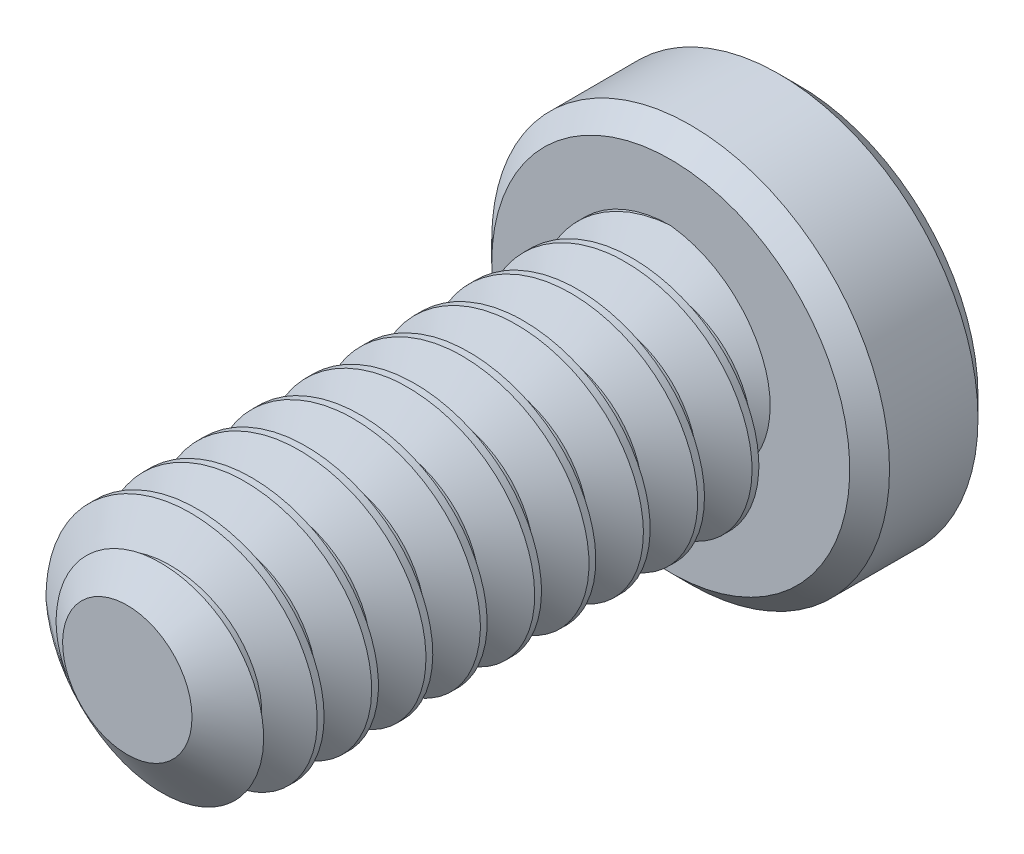
from build123d import *

# Parameters (mm, degrees)
SKETCH1_R          = 1.4224
EXTRUDE1_DEPTH     = 6.35
CUT_SWEEP1_PITCH   = 0.635
SKETCH6_R          = 2.3241
EXTRUDE2_DEPTH     = 1.4986
CUT_EXTRUDE1_DEPTH = 0.9525
CHAMFER1_SIZE      = 0.23241


with BuildPart() as part:
    # Sketch1 → Extrude1 (new body)
    with BuildSketch(Plane.XY):
        Circle(SKETCH1_R)
    extrude(amount=-EXTRUDE1_DEPTH)

    # Cut-Sweep1: the profile of Sketch3 profile screwed along a right-hand helix of 11 turns, 6 arcs to a turn; built about Z, then put on its axis
    cut_sweep1_z = Axis((0, 0, 0), (0, 0, 1))
    cut_sweep1_corners = [(1.4227, 0, -0.555798205), (1.009955401, 0, -0.3175), (1.009955401, 0, -0.238125), (1.4227, 0, 0.000173205)]
    with BuildLine(mode=Mode.PRIVATE) as cut_sweep1_profile:
        Line(cut_sweep1_corners[0], cut_sweep1_corners[1])
        Line(cut_sweep1_corners[1], cut_sweep1_corners[2])
        Line(cut_sweep1_corners[2], cut_sweep1_corners[3])
        Line(cut_sweep1_corners[3], cut_sweep1_corners[0])
    cut_sweep1_cap = Face(cut_sweep1_profile.wire())
    cut_sweep1_turn_angles = [0, 30, 60, 90, 120, 150, 180, 210, 240, 270, 300, 330, 360]
    cut_sweep1_turn_weights = [1, 0.8660254037844387, 1, 0.8660254037844387, 1, 0.8660254037844387, 1, 0.8660254037844387, 1, 0.8660254037844387, 1, 0.8660254037844387, 1]
    cut_sweep1_turn_rails = [Edge.make_bspline([Vector(p[0], p[1], 0).rotate(cut_sweep1_z, cut_sweep1_turn_angles[k]) / cut_sweep1_turn_weights[k] + Vector(0, 0, p[2] + CUT_SWEEP1_PITCH * cut_sweep1_turn_angles[k] / 360) for k in range(13)], [0, 0, 0, 1, 1, 2, 2, 3, 3, 4, 4, 5, 5, 6, 6, 6], 2, cut_sweep1_turn_weights) for p in cut_sweep1_corners]
    cut_sweep1_turn_sides = [Face.make_surface_from_curves(cut_sweep1_turn_rails[p[0]], cut_sweep1_turn_rails[p[1]]) for p in [(0, 1), (1, 2), (2, 3), (3, 0)]]
    cut_sweep1 = Plane(origin=(0, 0, 0), x_dir=(0, 1, 0), z_dir=(0, 0, -1)) * Solid(Shell([*[p.moved(Location((0, 0, CUT_SWEEP1_PITCH * i))) for i in range(11) for p in cut_sweep1_turn_sides], cut_sweep1_cap, cut_sweep1_cap.rotate(cut_sweep1_z, 3960).moved(Location((0, 0, CUT_SWEEP1_PITCH * 3960 / 360)))]))
    add(cut_sweep1, mode=Mode.SUBTRACT)

    # Sketch4 → Cut-Revolve1 (revolve, cut)
    with BuildSketch(Plane(origin=(0, 0, 0), x_dir=(0, 0, -1), z_dir=(1, 0, 0)), mode=Mode.PRIVATE) as cut_revolve1_sk:
        Polygon((0.466649532, 1.4224), (0, 0.755955401), (0, 1.4224), align=None)
    revolve(cut_revolve1_sk.sketch.rotate(Axis((0, 0, 0), (0, 0, -1)), 264.795368264), axis=Axis((0, 0, 0), (0, 0, -1)), mode=Mode.SUBTRACT)

    # Sketch6 → Extrude2 (add)
    with BuildSketch(Plane(origin=(0, 0, -6.35), x_dir=(-1, 0, 0), z_dir=(0, 0, -1))):
        with Locations(Location((0, 0, 0), (0, 0, 180))):
            Circle(SKETCH6_R)
    extrude(amount=EXTRUDE2_DEPTH)

    # Sketch7 → Cut-Extrude1 (cut)
    with BuildSketch(Plane(origin=(0, 0, -7.8486), x_dir=(-1, 0, 0), z_dir=(0, 0, -1))):
        Polygon((0, 0.733234842), (-0.635, 0.366617421), (-0.635, -0.366617421), (0, -0.733234842), (0.635, -0.366617421), (0.635, 0.366617421), align=None)
    extrude(amount=-CUT_EXTRUDE1_DEPTH, mode=Mode.SUBTRACT)

    # Cut-Extrude2 cone 1 section (through the dimple's axis) → Cut-Extrude2 (revolve, cut)
    with BuildSketch(Plane(origin=(0, 0, -7.8486), x_dir=(0, 1, 0), z_dir=(1, 0, 0))):
        Polygon((0, 0), (0.733234842, 0), (0, 0.733234842), align=None)
    revolve(axis=Axis((0, 0, -7.8486), (0, 0, 1)), mode=Mode.SUBTRACT)

    # Chamfer1
    chamfer1_edges = [part.edges().sort_by_distance(p)[0] for p in [
        (-2.3241, 0, -6.35),
        (-2.3241, 0, -7.8486),
    ]]
    chamfer(chamfer1_edges, length=CHAMFER1_SIZE)


solid = part.part
